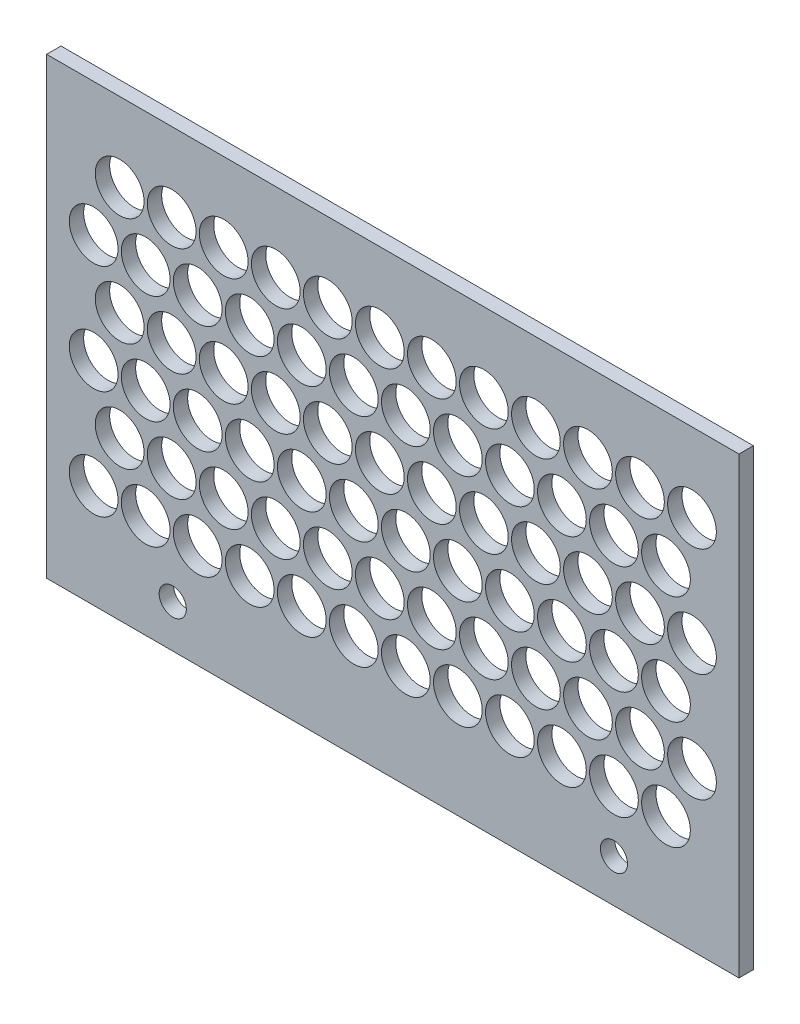
from build123d import *

# Parameters (mm, degrees)
SKETCH1_W                  = 306.05000007
SKETCH1_H                  = 197.4250001
BOSS_EXTRUDE1_DEPTH        = 6.35
CUT_EXTRUDE1_DEPTH         = 187.132543615
SKETCH4_R                  = 10.775
CUT_EXTRUDE2_DEPTH         = 187.132543615
LPATTERN1_COUNT            = 12
LPATTERN1_PITCH            = 23
LPATTERN2_COPY_1_DEPTH     = 187.132543615
LPATTERN2_COPY_2_DEPTH     = 187.132543615
LPATTERN2_COPY_3_DEPTH     = 187.132543615
LPATTERN2_COPY_4_DEPTH     = 187.132543615
LPATTERN2_COPY_5_DEPTH     = 187.132543615
LPATTERN2_COPY_6_DEPTH     = 187.132543615
LPATTERN2_COPY_7_DEPTH     = 187.132543615
LPATTERN2_COPY_8_DEPTH     = 187.132543615
LPATTERN2_COPY_9_DEPTH     = 187.132543615
LPATTERN2_COPY_10_DEPTH    = 187.132543615
LPATTERN2_COPY_11_DEPTH    = 187.132543615
LPATTERN2_COPY_12_DEPTH    = 187.132543615
LPATTERN2_COPY_13_DEPTH    = 187.132543615
LPATTERN2_COPY_14_DEPTH    = 187.132543615
LPATTERN2_COPY_15_DEPTH    = 187.132543615
LPATTERN2_COPY_16_DEPTH    = 187.132543615
LPATTERN2_COPY_17_DEPTH    = 187.132543615
LPATTERN2_COPY_18_DEPTH    = 187.132543615
LPATTERN2_COPY_19_DEPTH    = 187.132543615
LPATTERN2_COPY_20_DEPTH    = 187.132543615
LPATTERN2_COPY_21_DEPTH    = 187.132543615
LPATTERN2_COPY_22_DEPTH    = 187.132543615
LPATTERN2_COPY_23_SKETCH_R = 10.775
LPATTERN2_COPY_23_DEPTH    = 187.132543615
LPATTERN2_COPY_24_SKETCH_R = 10.775
LPATTERN2_COPY_24_DEPTH    = 187.132543615
LPATTERN2_COPY_25_SKETCH_R = 10.775
LPATTERN2_COPY_25_DEPTH    = 187.132543615
LPATTERN2_COPY_26_SKETCH_R = 10.775
LPATTERN2_COPY_26_DEPTH    = 187.132543615
LPATTERN2_COPY_27_SKETCH_R = 10.775
LPATTERN2_COPY_27_DEPTH    = 187.132543615
LPATTERN2_COPY_28_SKETCH_R = 10.775
LPATTERN2_COPY_28_DEPTH    = 187.132543615
LPATTERN2_COPY_29_SKETCH_R = 10.775
LPATTERN2_COPY_29_DEPTH    = 187.132543615
LPATTERN2_COPY_30_SKETCH_R = 10.775
LPATTERN2_COPY_30_DEPTH    = 187.132543615
LPATTERN2_COPY_31_SKETCH_R = 10.775
LPATTERN2_COPY_31_DEPTH    = 187.132543615
LPATTERN2_COPY_32_SKETCH_R = 10.775
LPATTERN2_COPY_32_DEPTH    = 187.132543615
LPATTERN2_COPY_33_SKETCH_R = 10.775
LPATTERN2_COPY_33_DEPTH    = 187.132543615
LPATTERN2_COPY_34_SKETCH_R = 10.775
LPATTERN2_COPY_34_DEPTH    = 187.132543615
LPATTERN2_COPY_35_SKETCH_R = 10.775
LPATTERN2_COPY_35_DEPTH    = 187.132543615
LPATTERN2_COPY_36_SKETCH_R = 10.775
LPATTERN2_COPY_36_DEPTH    = 187.132543615
LPATTERN2_COPY_37_SKETCH_R = 10.775
LPATTERN2_COPY_37_DEPTH    = 187.132543615
LPATTERN2_COPY_38_SKETCH_R = 10.775
LPATTERN2_COPY_38_DEPTH    = 187.132543615
LPATTERN2_COPY_39_SKETCH_R = 10.775
LPATTERN2_COPY_39_DEPTH    = 187.132543615
LPATTERN2_COPY_40_SKETCH_R = 10.775
LPATTERN2_COPY_40_DEPTH    = 187.132543615
LPATTERN2_COPY_41_SKETCH_R = 10.775
LPATTERN2_COPY_41_DEPTH    = 187.132543615
LPATTERN2_COPY_42_SKETCH_R = 10.775
LPATTERN2_COPY_42_DEPTH    = 187.132543615
LPATTERN2_COPY_43_SKETCH_R = 10.775
LPATTERN2_COPY_43_DEPTH    = 187.132543615
LPATTERN2_COPY_44_SKETCH_R = 10.775
LPATTERN2_COPY_44_DEPTH    = 187.132543615
LPATTERN2_COPY_45_DEPTH    = 187.132543615
LPATTERN2_COPY_46_DEPTH    = 187.132543615
LPATTERN2_COPY_47_SKETCH_R = 10.775
LPATTERN2_COPY_47_DEPTH    = 187.132543615
LPATTERN2_COPY_48_SKETCH_R = 10.775
LPATTERN2_COPY_48_DEPTH    = 187.132543615
SKETCH13_W                 = 306.05000007
SKETCH13_H                 = 6.35
BOSS_EXTRUDE2_DEPTH        = 3.175
SKETCH14_R                 = 6
CUT_EXTRUDE3_DEPTH         = 187.132543615


with BuildPart() as part:
    # Sketch1 → Boss-Extrude1 (new body)
    with BuildSketch(Plane.XY):
        with Locations((3.5e-08, -7.06250005)):
            Rectangle(SKETCH1_W, SKETCH1_H)
    extrude(amount=BOSS_EXTRUDE1_DEPTH)

    # Sketch3 → Cut-Extrude1 (cut, through all)
    with BuildSketch(Plane.XY.offset(6.35)):
        with BuildLine():
            ThreePointArc((-121.475, -60), (-132.24999993, -49.225), (-143.025, -59.999999859))
            ThreePointArc((-143.025, -59.999999859), (-139.869075617, -67.619075517), (-132.25, -70.775))
            ThreePointArc((-132.25, -70.775), (-124.630924433, -67.619075567), (-121.475, -60))
        make_face()
    cut_extrude1 = extrude(amount=-CUT_EXTRUDE1_DEPTH, mode=Mode.SUBTRACT)

    # Sketch4 → Cut-Extrude2 (cut, through all)
    with BuildSketch(Plane.XY.offset(6.35)):
        with Locations((-120.75, -36)):
            Circle(SKETCH4_R)
    cut_extrude2 = extrude(amount=-CUT_EXTRUDE2_DEPTH, mode=Mode.SUBTRACT)

    # LPattern1: Cut-Extrude1, Cut-Extrude2 ×12
    with Locations(*[(i * LPATTERN1_PITCH, 0, 0) for i in range(1, LPATTERN1_COUNT)]):
        add(cut_extrude1, mode=Mode.SUBTRACT)
        add(cut_extrude2, mode=Mode.SUBTRACT)

    # LPattern2 copy 1 sketch → LPattern2 copy 1 (cut, through all)
    with BuildSketch(Plane(origin=(23, 48, 6.35), x_dir=(1, 0, 0), z_dir=(0, 0, 1))):
        with BuildLine():
            ThreePointArc((-121.475, -60), (-132.24999993, -49.225), (-143.025, -59.999999859))
            ThreePointArc((-143.025, -59.999999859), (-139.869075617, -67.619075517), (-132.25, -70.775))
            ThreePointArc((-132.25, -70.775), (-124.630924433, -67.619075567), (-121.475, -60))
        make_face()
    extrude(amount=-LPATTERN2_COPY_1_DEPTH, mode=Mode.SUBTRACT)

    # LPattern2 copy 2 sketch → LPattern2 copy 2 (cut, through all)
    with BuildSketch(Plane(origin=(23, 96, 6.35), x_dir=(1, 0, 0), z_dir=(0, 0, 1))):
        with BuildLine():
            ThreePointArc((-121.475, -60), (-132.24999993, -49.225), (-143.025, -59.999999859))
            ThreePointArc((-143.025, -59.999999859), (-139.869075617, -67.619075517), (-132.25, -70.775))
            ThreePointArc((-132.25, -70.775), (-124.630924433, -67.619075567), (-121.475, -60))
        make_face()
    extrude(amount=-LPATTERN2_COPY_2_DEPTH, mode=Mode.SUBTRACT)

    # LPattern2 copy 3 sketch → LPattern2 copy 3 (cut, through all)
    with BuildSketch(Plane(origin=(46, 48, 6.35), x_dir=(1, 0, 0), z_dir=(0, 0, 1))):
        with BuildLine():
            ThreePointArc((-121.475, -60), (-132.24999993, -49.225), (-143.025, -59.999999859))
            ThreePointArc((-143.025, -59.999999859), (-139.869075617, -67.619075517), (-132.25, -70.775))
            ThreePointArc((-132.25, -70.775), (-124.630924433, -67.619075567), (-121.475, -60))
        make_face()
    extrude(amount=-LPATTERN2_COPY_3_DEPTH, mode=Mode.SUBTRACT)

    # LPattern2 copy 4 sketch → LPattern2 copy 4 (cut, through all)
    with BuildSketch(Plane(origin=(46, 96, 6.35), x_dir=(1, 0, 0), z_dir=(0, 0, 1))):
        with BuildLine():
            ThreePointArc((-121.475, -60), (-132.24999993, -49.225), (-143.025, -59.999999859))
            ThreePointArc((-143.025, -59.999999859), (-139.869075617, -67.619075517), (-132.25, -70.775))
            ThreePointArc((-132.25, -70.775), (-124.630924433, -67.619075567), (-121.475, -60))
        make_face()
    extrude(amount=-LPATTERN2_COPY_4_DEPTH, mode=Mode.SUBTRACT)

    # LPattern2 copy 5 sketch → LPattern2 copy 5 (cut, through all)
    with BuildSketch(Plane(origin=(69, 48, 6.35), x_dir=(1, 0, 0), z_dir=(0, 0, 1))):
        with BuildLine():
            ThreePointArc((-121.475, -60), (-132.24999993, -49.225), (-143.025, -59.999999859))
            ThreePointArc((-143.025, -59.999999859), (-139.869075617, -67.619075517), (-132.25, -70.775))
            ThreePointArc((-132.25, -70.775), (-124.630924433, -67.619075567), (-121.475, -60))
        make_face()
    extrude(amount=-LPATTERN2_COPY_5_DEPTH, mode=Mode.SUBTRACT)

    # LPattern2 copy 6 sketch → LPattern2 copy 6 (cut, through all)
    with BuildSketch(Plane(origin=(69, 96, 6.35), x_dir=(1, 0, 0), z_dir=(0, 0, 1))):
        with BuildLine():
            ThreePointArc((-121.475, -60), (-132.24999993, -49.225), (-143.025, -59.999999859))
            ThreePointArc((-143.025, -59.999999859), (-139.869075617, -67.619075517), (-132.25, -70.775))
            ThreePointArc((-132.25, -70.775), (-124.630924433, -67.619075567), (-121.475, -60))
        make_face()
    extrude(amount=-LPATTERN2_COPY_6_DEPTH, mode=Mode.SUBTRACT)

    # LPattern2 copy 7 sketch → LPattern2 copy 7 (cut, through all)
    with BuildSketch(Plane(origin=(92, 48, 6.35), x_dir=(1, 0, 0), z_dir=(0, 0, 1))):
        with BuildLine():
            ThreePointArc((-121.475, -60), (-132.24999993, -49.225), (-143.025, -59.999999859))
            ThreePointArc((-143.025, -59.999999859), (-139.869075617, -67.619075517), (-132.25, -70.775))
            ThreePointArc((-132.25, -70.775), (-124.630924433, -67.619075567), (-121.475, -60))
        make_face()
    extrude(amount=-LPATTERN2_COPY_7_DEPTH, mode=Mode.SUBTRACT)

    # LPattern2 copy 8 sketch → LPattern2 copy 8 (cut, through all)
    with BuildSketch(Plane(origin=(92, 96, 6.35), x_dir=(1, 0, 0), z_dir=(0, 0, 1))):
        with BuildLine():
            ThreePointArc((-121.475, -60), (-132.24999993, -49.225), (-143.025, -59.999999859))
            ThreePointArc((-143.025, -59.999999859), (-139.869075617, -67.619075517), (-132.25, -70.775))
            ThreePointArc((-132.25, -70.775), (-124.630924433, -67.619075567), (-121.475, -60))
        make_face()
    extrude(amount=-LPATTERN2_COPY_8_DEPTH, mode=Mode.SUBTRACT)

    # LPattern2 copy 9 sketch → LPattern2 copy 9 (cut, through all)
    with BuildSketch(Plane(origin=(115, 48, 6.35), x_dir=(1, 0, 0), z_dir=(0, 0, 1))):
        with BuildLine():
            ThreePointArc((-121.475, -60), (-132.24999993, -49.225), (-143.025, -59.999999859))
            ThreePointArc((-143.025, -59.999999859), (-139.869075617, -67.619075517), (-132.25, -70.775))
            ThreePointArc((-132.25, -70.775), (-124.630924433, -67.619075567), (-121.475, -60))
        make_face()
    extrude(amount=-LPATTERN2_COPY_9_DEPTH, mode=Mode.SUBTRACT)

    # LPattern2 copy 10 sketch → LPattern2 copy 10 (cut, through all)
    with BuildSketch(Plane(origin=(115, 96, 6.35), x_dir=(1, 0, 0), z_dir=(0, 0, 1))):
        with BuildLine():
            ThreePointArc((-121.475, -60), (-132.24999993, -49.225), (-143.025, -59.999999859))
            ThreePointArc((-143.025, -59.999999859), (-139.869075617, -67.619075517), (-132.25, -70.775))
            ThreePointArc((-132.25, -70.775), (-124.630924433, -67.619075567), (-121.475, -60))
        make_face()
    extrude(amount=-LPATTERN2_COPY_10_DEPTH, mode=Mode.SUBTRACT)

    # LPattern2 copy 11 sketch → LPattern2 copy 11 (cut, through all)
    with BuildSketch(Plane(origin=(138, 48, 6.35), x_dir=(1, 0, 0), z_dir=(0, 0, 1))):
        with BuildLine():
            ThreePointArc((-121.475, -60), (-132.24999993, -49.225), (-143.025, -59.999999859))
            ThreePointArc((-143.025, -59.999999859), (-139.869075617, -67.619075517), (-132.25, -70.775))
            ThreePointArc((-132.25, -70.775), (-124.630924433, -67.619075567), (-121.475, -60))
        make_face()
    extrude(amount=-LPATTERN2_COPY_11_DEPTH, mode=Mode.SUBTRACT)

    # LPattern2 copy 12 sketch → LPattern2 copy 12 (cut, through all)
    with BuildSketch(Plane(origin=(138, 96, 6.35), x_dir=(1, 0, 0), z_dir=(0, 0, 1))):
        with BuildLine():
            ThreePointArc((-121.475, -60), (-132.24999993, -49.225), (-143.025, -59.999999859))
            ThreePointArc((-143.025, -59.999999859), (-139.869075617, -67.619075517), (-132.25, -70.775))
            ThreePointArc((-132.25, -70.775), (-124.630924433, -67.619075567), (-121.475, -60))
        make_face()
    extrude(amount=-LPATTERN2_COPY_12_DEPTH, mode=Mode.SUBTRACT)

    # LPattern2 copy 13 sketch → LPattern2 copy 13 (cut, through all)
    with BuildSketch(Plane(origin=(161, 48, 6.35), x_dir=(1, 0, 0), z_dir=(0, 0, 1))):
        with BuildLine():
            ThreePointArc((-121.475, -60), (-132.24999993, -49.225), (-143.025, -59.999999859))
            ThreePointArc((-143.025, -59.999999859), (-139.869075617, -67.619075517), (-132.25, -70.775))
            ThreePointArc((-132.25, -70.775), (-124.630924433, -67.619075567), (-121.475, -60))
        make_face()
    extrude(amount=-LPATTERN2_COPY_13_DEPTH, mode=Mode.SUBTRACT)

    # LPattern2 copy 14 sketch → LPattern2 copy 14 (cut, through all)
    with BuildSketch(Plane(origin=(161, 96, 6.35), x_dir=(1, 0, 0), z_dir=(0, 0, 1))):
        with BuildLine():
            ThreePointArc((-121.475, -60), (-132.24999993, -49.225), (-143.025, -59.999999859))
            ThreePointArc((-143.025, -59.999999859), (-139.869075617, -67.619075517), (-132.25, -70.775))
            ThreePointArc((-132.25, -70.775), (-124.630924433, -67.619075567), (-121.475, -60))
        make_face()
    extrude(amount=-LPATTERN2_COPY_14_DEPTH, mode=Mode.SUBTRACT)

    # LPattern2 copy 15 sketch → LPattern2 copy 15 (cut, through all)
    with BuildSketch(Plane(origin=(184, 48, 6.35), x_dir=(1, 0, 0), z_dir=(0, 0, 1))):
        with BuildLine():
            ThreePointArc((-121.475, -60), (-132.24999993, -49.225), (-143.025, -59.999999859))
            ThreePointArc((-143.025, -59.999999859), (-139.869075617, -67.619075517), (-132.25, -70.775))
            ThreePointArc((-132.25, -70.775), (-124.630924433, -67.619075567), (-121.475, -60))
        make_face()
    extrude(amount=-LPATTERN2_COPY_15_DEPTH, mode=Mode.SUBTRACT)

    # LPattern2 copy 16 sketch → LPattern2 copy 16 (cut, through all)
    with BuildSketch(Plane(origin=(184, 96, 6.35), x_dir=(1, 0, 0), z_dir=(0, 0, 1))):
        with BuildLine():
            ThreePointArc((-121.475, -60), (-132.24999993, -49.225), (-143.025, -59.999999859))
            ThreePointArc((-143.025, -59.999999859), (-139.869075617, -67.619075517), (-132.25, -70.775))
            ThreePointArc((-132.25, -70.775), (-124.630924433, -67.619075567), (-121.475, -60))
        make_face()
    extrude(amount=-LPATTERN2_COPY_16_DEPTH, mode=Mode.SUBTRACT)

    # LPattern2 copy 17 sketch → LPattern2 copy 17 (cut, through all)
    with BuildSketch(Plane(origin=(207, 48, 6.35), x_dir=(1, 0, 0), z_dir=(0, 0, 1))):
        with BuildLine():
            ThreePointArc((-121.475, -60), (-132.24999993, -49.225), (-143.025, -59.999999859))
            ThreePointArc((-143.025, -59.999999859), (-139.869075617, -67.619075517), (-132.25, -70.775))
            ThreePointArc((-132.25, -70.775), (-124.630924433, -67.619075567), (-121.475, -60))
        make_face()
    extrude(amount=-LPATTERN2_COPY_17_DEPTH, mode=Mode.SUBTRACT)

    # LPattern2 copy 18 sketch → LPattern2 copy 18 (cut, through all)
    with BuildSketch(Plane(origin=(207, 96, 6.35), x_dir=(1, 0, 0), z_dir=(0, 0, 1))):
        with BuildLine():
            ThreePointArc((-121.475, -60), (-132.24999993, -49.225), (-143.025, -59.999999859))
            ThreePointArc((-143.025, -59.999999859), (-139.869075617, -67.619075517), (-132.25, -70.775))
            ThreePointArc((-132.25, -70.775), (-124.630924433, -67.619075567), (-121.475, -60))
        make_face()
    extrude(amount=-LPATTERN2_COPY_18_DEPTH, mode=Mode.SUBTRACT)

    # LPattern2 copy 19 sketch → LPattern2 copy 19 (cut, through all)
    with BuildSketch(Plane(origin=(230, 48, 6.35), x_dir=(1, 0, 0), z_dir=(0, 0, 1))):
        with BuildLine():
            ThreePointArc((-121.475, -60), (-132.24999993, -49.225), (-143.025, -59.999999859))
            ThreePointArc((-143.025, -59.999999859), (-139.869075617, -67.619075517), (-132.25, -70.775))
            ThreePointArc((-132.25, -70.775), (-124.630924433, -67.619075567), (-121.475, -60))
        make_face()
    extrude(amount=-LPATTERN2_COPY_19_DEPTH, mode=Mode.SUBTRACT)

    # LPattern2 copy 20 sketch → LPattern2 copy 20 (cut, through all)
    with BuildSketch(Plane(origin=(230, 96, 6.35), x_dir=(1, 0, 0), z_dir=(0, 0, 1))):
        with BuildLine():
            ThreePointArc((-121.475, -60), (-132.24999993, -49.225), (-143.025, -59.999999859))
            ThreePointArc((-143.025, -59.999999859), (-139.869075617, -67.619075517), (-132.25, -70.775))
            ThreePointArc((-132.25, -70.775), (-124.630924433, -67.619075567), (-121.475, -60))
        make_face()
    extrude(amount=-LPATTERN2_COPY_20_DEPTH, mode=Mode.SUBTRACT)

    # LPattern2 copy 21 sketch → LPattern2 copy 21 (cut, through all)
    with BuildSketch(Plane(origin=(253, 48, 6.35), x_dir=(1, 0, 0), z_dir=(0, 0, 1))):
        with BuildLine():
            ThreePointArc((-121.475, -60), (-132.24999993, -49.225), (-143.025, -59.999999859))
            ThreePointArc((-143.025, -59.999999859), (-139.869075617, -67.619075517), (-132.25, -70.775))
            ThreePointArc((-132.25, -70.775), (-124.630924433, -67.619075567), (-121.475, -60))
        make_face()
    extrude(amount=-LPATTERN2_COPY_21_DEPTH, mode=Mode.SUBTRACT)

    # LPattern2 copy 22 sketch → LPattern2 copy 22 (cut, through all)
    with BuildSketch(Plane(origin=(253, 96, 6.35), x_dir=(1, 0, 0), z_dir=(0, 0, 1))):
        with BuildLine():
            ThreePointArc((-121.475, -60), (-132.24999993, -49.225), (-143.025, -59.999999859))
            ThreePointArc((-143.025, -59.999999859), (-139.869075617, -67.619075517), (-132.25, -70.775))
            ThreePointArc((-132.25, -70.775), (-124.630924433, -67.619075567), (-121.475, -60))
        make_face()
    extrude(amount=-LPATTERN2_COPY_22_DEPTH, mode=Mode.SUBTRACT)

    # LPattern2 copy 23 sketch → LPattern2 copy 23 (cut, through all)
    with BuildSketch(Plane(origin=(23, 48, 6.35), x_dir=(1, 0, 0), z_dir=(0, 0, 1))):
        with Locations((-120.75, -36)):
            Circle(LPATTERN2_COPY_23_SKETCH_R)
    extrude(amount=-LPATTERN2_COPY_23_DEPTH, mode=Mode.SUBTRACT)

    # LPattern2 copy 24 sketch → LPattern2 copy 24 (cut, through all)
    with BuildSketch(Plane(origin=(23, 96, 6.35), x_dir=(1, 0, 0), z_dir=(0, 0, 1))):
        with Locations((-120.75, -36)):
            Circle(LPATTERN2_COPY_24_SKETCH_R)
    extrude(amount=-LPATTERN2_COPY_24_DEPTH, mode=Mode.SUBTRACT)

    # LPattern2 copy 25 sketch → LPattern2 copy 25 (cut, through all)
    with BuildSketch(Plane(origin=(46, 48, 6.35), x_dir=(1, 0, 0), z_dir=(0, 0, 1))):
        with Locations((-120.75, -36)):
            Circle(LPATTERN2_COPY_25_SKETCH_R)
    extrude(amount=-LPATTERN2_COPY_25_DEPTH, mode=Mode.SUBTRACT)

    # LPattern2 copy 26 sketch → LPattern2 copy 26 (cut, through all)
    with BuildSketch(Plane(origin=(46, 96, 6.35), x_dir=(1, 0, 0), z_dir=(0, 0, 1))):
        with Locations((-120.75, -36)):
            Circle(LPATTERN2_COPY_26_SKETCH_R)
    extrude(amount=-LPATTERN2_COPY_26_DEPTH, mode=Mode.SUBTRACT)

    # LPattern2 copy 27 sketch → LPattern2 copy 27 (cut, through all)
    with BuildSketch(Plane(origin=(69, 48, 6.35), x_dir=(1, 0, 0), z_dir=(0, 0, 1))):
        with Locations((-120.75, -36)):
            Circle(LPATTERN2_COPY_27_SKETCH_R)
    extrude(amount=-LPATTERN2_COPY_27_DEPTH, mode=Mode.SUBTRACT)

    # LPattern2 copy 28 sketch → LPattern2 copy 28 (cut, through all)
    with BuildSketch(Plane(origin=(69, 96, 6.35), x_dir=(1, 0, 0), z_dir=(0, 0, 1))):
        with Locations((-120.75, -36)):
            Circle(LPATTERN2_COPY_28_SKETCH_R)
    extrude(amount=-LPATTERN2_COPY_28_DEPTH, mode=Mode.SUBTRACT)

    # LPattern2 copy 29 sketch → LPattern2 copy 29 (cut, through all)
    with BuildSketch(Plane(origin=(92, 48, 6.35), x_dir=(1, 0, 0), z_dir=(0, 0, 1))):
        with Locations((-120.75, -36)):
            Circle(LPATTERN2_COPY_29_SKETCH_R)
    extrude(amount=-LPATTERN2_COPY_29_DEPTH, mode=Mode.SUBTRACT)

    # LPattern2 copy 30 sketch → LPattern2 copy 30 (cut, through all)
    with BuildSketch(Plane(origin=(92, 96, 6.35), x_dir=(1, 0, 0), z_dir=(0, 0, 1))):
        with Locations((-120.75, -36)):
            Circle(LPATTERN2_COPY_30_SKETCH_R)
    extrude(amount=-LPATTERN2_COPY_30_DEPTH, mode=Mode.SUBTRACT)

    # LPattern2 copy 31 sketch → LPattern2 copy 31 (cut, through all)
    with BuildSketch(Plane(origin=(115, 48, 6.35), x_dir=(1, 0, 0), z_dir=(0, 0, 1))):
        with Locations((-120.75, -36)):
            Circle(LPATTERN2_COPY_31_SKETCH_R)
    extrude(amount=-LPATTERN2_COPY_31_DEPTH, mode=Mode.SUBTRACT)

    # LPattern2 copy 32 sketch → LPattern2 copy 32 (cut, through all)
    with BuildSketch(Plane(origin=(115, 96, 6.35), x_dir=(1, 0, 0), z_dir=(0, 0, 1))):
        with Locations((-120.75, -36)):
            Circle(LPATTERN2_COPY_32_SKETCH_R)
    extrude(amount=-LPATTERN2_COPY_32_DEPTH, mode=Mode.SUBTRACT)

    # LPattern2 copy 33 sketch → LPattern2 copy 33 (cut, through all)
    with BuildSketch(Plane(origin=(138, 48, 6.35), x_dir=(1, 0, 0), z_dir=(0, 0, 1))):
        with Locations((-120.75, -36)):
            Circle(LPATTERN2_COPY_33_SKETCH_R)
    extrude(amount=-LPATTERN2_COPY_33_DEPTH, mode=Mode.SUBTRACT)

    # LPattern2 copy 34 sketch → LPattern2 copy 34 (cut, through all)
    with BuildSketch(Plane(origin=(138, 96, 6.35), x_dir=(1, 0, 0), z_dir=(0, 0, 1))):
        with Locations((-120.75, -36)):
            Circle(LPATTERN2_COPY_34_SKETCH_R)
    extrude(amount=-LPATTERN2_COPY_34_DEPTH, mode=Mode.SUBTRACT)

    # LPattern2 copy 35 sketch → LPattern2 copy 35 (cut, through all)
    with BuildSketch(Plane(origin=(161, 48, 6.35), x_dir=(1, 0, 0), z_dir=(0, 0, 1))):
        with Locations((-120.75, -36)):
            Circle(LPATTERN2_COPY_35_SKETCH_R)
    extrude(amount=-LPATTERN2_COPY_35_DEPTH, mode=Mode.SUBTRACT)

    # LPattern2 copy 36 sketch → LPattern2 copy 36 (cut, through all)
    with BuildSketch(Plane(origin=(161, 96, 6.35), x_dir=(1, 0, 0), z_dir=(0, 0, 1))):
        with Locations((-120.75, -36)):
            Circle(LPATTERN2_COPY_36_SKETCH_R)
    extrude(amount=-LPATTERN2_COPY_36_DEPTH, mode=Mode.SUBTRACT)

    # LPattern2 copy 37 sketch → LPattern2 copy 37 (cut, through all)
    with BuildSketch(Plane(origin=(184, 48, 6.35), x_dir=(1, 0, 0), z_dir=(0, 0, 1))):
        with Locations((-120.75, -36)):
            Circle(LPATTERN2_COPY_37_SKETCH_R)
    extrude(amount=-LPATTERN2_COPY_37_DEPTH, mode=Mode.SUBTRACT)

    # LPattern2 copy 38 sketch → LPattern2 copy 38 (cut, through all)
    with BuildSketch(Plane(origin=(184, 96, 6.35), x_dir=(1, 0, 0), z_dir=(0, 0, 1))):
        with Locations((-120.75, -36)):
            Circle(LPATTERN2_COPY_38_SKETCH_R)
    extrude(amount=-LPATTERN2_COPY_38_DEPTH, mode=Mode.SUBTRACT)

    # LPattern2 copy 39 sketch → LPattern2 copy 39 (cut, through all)
    with BuildSketch(Plane(origin=(207, 48, 6.35), x_dir=(1, 0, 0), z_dir=(0, 0, 1))):
        with Locations((-120.75, -36)):
            Circle(LPATTERN2_COPY_39_SKETCH_R)
    extrude(amount=-LPATTERN2_COPY_39_DEPTH, mode=Mode.SUBTRACT)

    # LPattern2 copy 40 sketch → LPattern2 copy 40 (cut, through all)
    with BuildSketch(Plane(origin=(207, 96, 6.35), x_dir=(1, 0, 0), z_dir=(0, 0, 1))):
        with Locations((-120.75, -36)):
            Circle(LPATTERN2_COPY_40_SKETCH_R)
    extrude(amount=-LPATTERN2_COPY_40_DEPTH, mode=Mode.SUBTRACT)

    # LPattern2 copy 41 sketch → LPattern2 copy 41 (cut, through all)
    with BuildSketch(Plane(origin=(230, 48, 6.35), x_dir=(1, 0, 0), z_dir=(0, 0, 1))):
        with Locations((-120.75, -36)):
            Circle(LPATTERN2_COPY_41_SKETCH_R)
    extrude(amount=-LPATTERN2_COPY_41_DEPTH, mode=Mode.SUBTRACT)

    # LPattern2 copy 42 sketch → LPattern2 copy 42 (cut, through all)
    with BuildSketch(Plane(origin=(230, 96, 6.35), x_dir=(1, 0, 0), z_dir=(0, 0, 1))):
        with Locations((-120.75, -36)):
            Circle(LPATTERN2_COPY_42_SKETCH_R)
    extrude(amount=-LPATTERN2_COPY_42_DEPTH, mode=Mode.SUBTRACT)

    # LPattern2 copy 43 sketch → LPattern2 copy 43 (cut, through all)
    with BuildSketch(Plane(origin=(253, 48, 6.35), x_dir=(1, 0, 0), z_dir=(0, 0, 1))):
        with Locations((-120.75, -36)):
            Circle(LPATTERN2_COPY_43_SKETCH_R)
    extrude(amount=-LPATTERN2_COPY_43_DEPTH, mode=Mode.SUBTRACT)

    # LPattern2 copy 44 sketch → LPattern2 copy 44 (cut, through all)
    with BuildSketch(Plane(origin=(253, 96, 6.35), x_dir=(1, 0, 0), z_dir=(0, 0, 1))):
        with Locations((-120.75, -36)):
            Circle(LPATTERN2_COPY_44_SKETCH_R)
    extrude(amount=-LPATTERN2_COPY_44_DEPTH, mode=Mode.SUBTRACT)

    # LPattern2 copy 45 sketch → LPattern2 copy 45 (cut, through all)
    with BuildSketch(Plane(origin=(0, 48, 6.35), x_dir=(1, 0, 0), z_dir=(0, 0, 1))):
        with BuildLine():
            ThreePointArc((-121.475, -60), (-132.24999993, -49.225), (-143.025, -59.999999859))
            ThreePointArc((-143.025, -59.999999859), (-139.869075617, -67.619075517), (-132.25, -70.775))
            ThreePointArc((-132.25, -70.775), (-124.630924433, -67.619075567), (-121.475, -60))
        make_face()
    extrude(amount=-LPATTERN2_COPY_45_DEPTH, mode=Mode.SUBTRACT)

    # LPattern2 copy 46 sketch → LPattern2 copy 46 (cut, through all)
    with BuildSketch(Plane(origin=(0, 96, 6.35), x_dir=(1, 0, 0), z_dir=(0, 0, 1))):
        with BuildLine():
            ThreePointArc((-121.475, -60), (-132.24999993, -49.225), (-143.025, -59.999999859))
            ThreePointArc((-143.025, -59.999999859), (-139.869075617, -67.619075517), (-132.25, -70.775))
            ThreePointArc((-132.25, -70.775), (-124.630924433, -67.619075567), (-121.475, -60))
        make_face()
    extrude(amount=-LPATTERN2_COPY_46_DEPTH, mode=Mode.SUBTRACT)

    # LPattern2 copy 47 sketch → LPattern2 copy 47 (cut, through all)
    with BuildSketch(Plane(origin=(0, 48, 6.35), x_dir=(1, 0, 0), z_dir=(0, 0, 1))):
        with Locations((-120.75, -36)):
            Circle(LPATTERN2_COPY_47_SKETCH_R)
    extrude(amount=-LPATTERN2_COPY_47_DEPTH, mode=Mode.SUBTRACT)

    # LPattern2 copy 48 sketch → LPattern2 copy 48 (cut, through all)
    with BuildSketch(Plane(origin=(0, 96, 6.35), x_dir=(1, 0, 0), z_dir=(0, 0, 1))):
        with Locations((-120.75, -36)):
            Circle(LPATTERN2_COPY_48_SKETCH_R)
    extrude(amount=-LPATTERN2_COPY_48_DEPTH, mode=Mode.SUBTRACT)

    # Sketch13 → Boss-Extrude2 (add)
    with BuildSketch(Plane(origin=(0, 91.65, 0), x_dir=(1, 0, 0), z_dir=(0, 1, 0))):
        with Locations((3.5e-08, -3.175)):
            Rectangle(SKETCH13_W, SKETCH13_H)
    extrude(amount=BOSS_EXTRUDE2_DEPTH)

    # Sketch14 → Cut-Extrude3 (cut, through all)
    with BuildSketch(Plane(origin=(0, 0, 0), x_dir=(-1, 0, 0), z_dir=(0, 0, -1))):
        with Locations((-97.75, -86.7750001)):
            Circle(SKETCH14_R)
        with Locations((97.288001, -86.7750001)):
            Circle(SKETCH14_R)
    extrude(amount=-CUT_EXTRUDE3_DEPTH, mode=Mode.SUBTRACT)


solid = part.part
